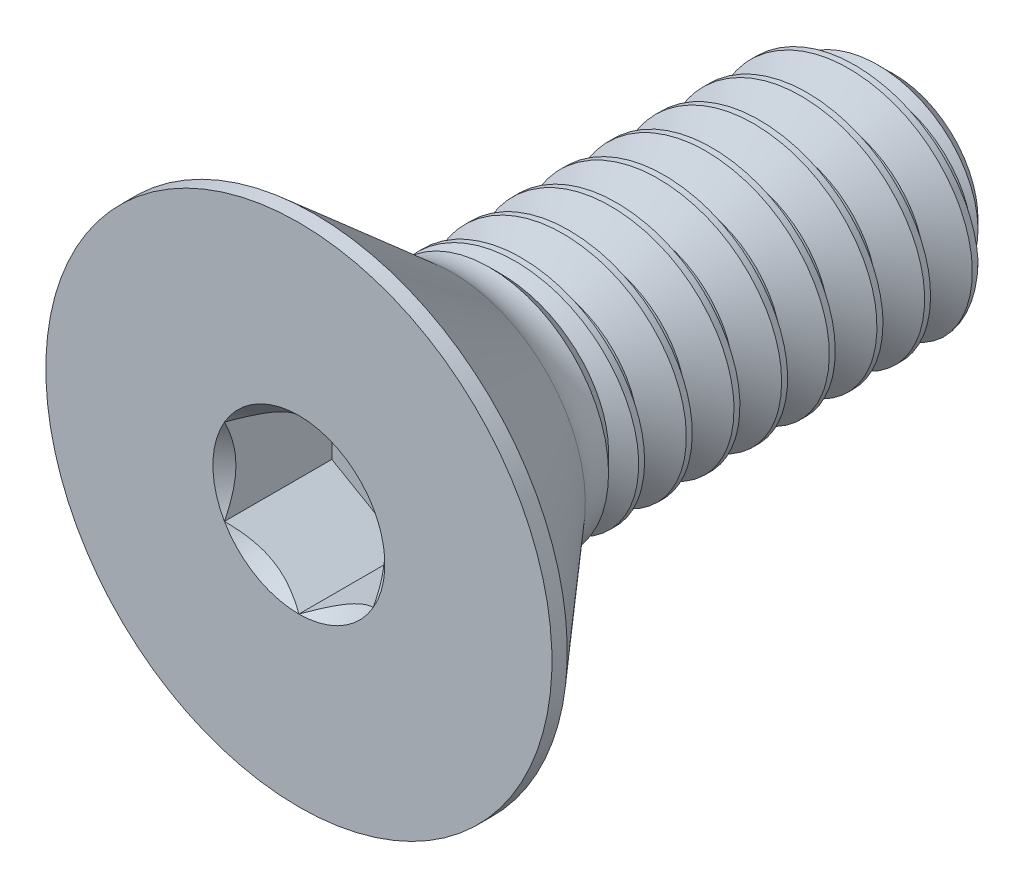
from build123d import *
from build123d.topology import SkipClean

# Parameters (mm, degrees)
SKETCH1_W          = 15.875
SKETCH1_H          = 3.175
CHAMFER1_SIZE      = 0.9525
CUT_SWEEP1_PITCH   = 1.27
CUT_EXTRUDE2_DEPTH = 2.86258


with BuildPart() as part:
    # Sketch1 → Revolve1 (revolve)
    with BuildSketch(Plane(origin=(0, 0, 0), x_dir=(0, 0, -1), z_dir=(1, 0, 0))):
        with Locations((7.9375, 1.5875)):
            Rectangle(SKETCH1_W, SKETCH1_H)
    revolve(axis=Axis((0, 0, -15.875), (0, 0, 1)))

    # Chamfer1
    chamfer1_edges = [part.edges().sort_by_distance(p)[0] for p in [
        (0, -3.175, -15.875),
    ]]
    chamfer(chamfer1_edges, length=CHAMFER1_SIZE)

    # Cut-Sweep1: the profile of Sketch2 profile screwed along a right-hand helix of 12.5 turns, 8 arcs to a turn; built about Z, then put on its axis
    with SkipClean():  # the faces are left unmerged after this step: merging them gives an invalid solid
        cut_sweep1_z = Axis((0, 0, 0), (0, 0, 1))
        cut_sweep1_corners = [(3.1756, 0, 0.00034641), (3.1756, 0, -1.11159641), (2.350110803, 0, -0.635), (2.350110803, 0, -0.47625)]
        with BuildLine(mode=Mode.PRIVATE) as cut_sweep1_profile:
            Line(cut_sweep1_corners[0], cut_sweep1_corners[1])
            Line(cut_sweep1_corners[1], cut_sweep1_corners[2])
            Line(cut_sweep1_corners[2], cut_sweep1_corners[3])
            Line(cut_sweep1_corners[3], cut_sweep1_corners[0])
        cut_sweep1_cap = Face(cut_sweep1_profile.wire())
        cut_sweep1_turn_angles = [0, 22.5, 45, 67.5, 90, 112.5, 135, 157.5, 180, 202.5, 225, 247.5, 270, 292.5, 315, 337.5, 360]
        cut_sweep1_turn_weights = [1, 0.9238795325112867, 1, 0.9238795325112867, 1, 0.9238795325112867, 1, 0.9238795325112867, 1, 0.9238795325112867, 1, 0.9238795325112867, 1, 0.9238795325112867, 1, 0.9238795325112867, 1]
        cut_sweep1_turn_rails = [Edge.make_bspline([Vector(p[0], p[1], 0).rotate(cut_sweep1_z, cut_sweep1_turn_angles[k]) / cut_sweep1_turn_weights[k] + Vector(0, 0, p[2] + CUT_SWEEP1_PITCH * cut_sweep1_turn_angles[k] / 360) for k in range(17)], [0, 0, 0, 1, 1, 2, 2, 3, 3, 4, 4, 5, 5, 6, 6, 7, 7, 8, 8, 8], 2, cut_sweep1_turn_weights) for p in cut_sweep1_corners]
        cut_sweep1_turn_sides = [Face.make_surface_from_curves(cut_sweep1_turn_rails[p[0]], cut_sweep1_turn_rails[p[1]]) for p in [(0, 1), (1, 2), (2, 3), (3, 0)]]
        cut_sweep1_last_angles = [4320, 4342.5, 4365, 4387.5, 4410, 4432.5, 4455, 4477.5, 4500]
        cut_sweep1_last_weights = [1, 0.9238795325112867, 1, 0.9238795325112867, 1, 0.9238795325112867, 1, 0.9238795325112837, 1]
        cut_sweep1_last_rails = [Edge.make_bspline([Vector(p[0], p[1], 0).rotate(cut_sweep1_z, cut_sweep1_last_angles[k]) / cut_sweep1_last_weights[k] + Vector(0, 0, p[2] + CUT_SWEEP1_PITCH * cut_sweep1_last_angles[k] / 360) for k in range(9)], [0, 0, 0, 1, 1, 2, 2, 3, 3, 4, 4, 4], 2, cut_sweep1_last_weights) for p in cut_sweep1_corners]
        cut_sweep1_last_sides = [Face.make_surface_from_curves(cut_sweep1_last_rails[p[0]], cut_sweep1_last_rails[p[1]]) for p in [(0, 1), (1, 2), (2, 3), (3, 0)]]
        cut_sweep1 = Plane(origin=(0, 0, -15.875), x_dir=(0, 1, 0), z_dir=(0, 0, 1)) * Solid(Shell([*[p.moved(Location((0, 0, CUT_SWEEP1_PITCH * i))) for i in range(12) for p in cut_sweep1_turn_sides], *cut_sweep1_last_sides, cut_sweep1_cap, cut_sweep1_cap.rotate(cut_sweep1_z, 4500).moved(Location((0, 0, CUT_SWEEP1_PITCH * 4500 / 360)))]))
        add(cut_sweep1, mode=Mode.SUBTRACT)

    # Sketch7 → Revolve2 (revolve)
    with BuildSketch(Plane(origin=(0, 0, 0), x_dir=(0, 0, -1), z_dir=(1, 0, 0)), mode=Mode.PRIVATE) as revolve2_sk:
        with BuildLine():
            Line((0, 6.7437), (0.40894, 6.7437))
            Line((0.40894, 6.7437), (4.0894, 3.544324933))
            ThreePointArc((4.0894, 3.544324933), (4.549909788, 3.270350399), (5.077204404, 3.175))
            Line((5.077204404, 3.175), (5.077204404, 0))
            Line((5.077204404, 0), (0, 0))
            Line((0, 0), (0, 6.7437))
        make_face()
    revolve(revolve2_sk.sketch.rotate(Axis((0, 0, 0), (0, 0, -1)), 189.052465709), axis=Axis((0, 0, 0), (0, 0, -1)))

    # Boss-Extrude1 cone 1 section (through the dimple's axis) → Boss-Extrude1 (revolve)
    with BuildSketch(Plane(origin=(0, 0, -5.077204404), x_dir=(0, -1, 0), z_dir=(1, 0, 0))):
        Polygon((0, 0), (3.175, 0), (0, 3.175), align=None)
    revolve(axis=Axis((0, 0, -5.077204404), (0, 0, -1)))

    # Sketch5 → Cut-Extrude2 (cut)
    with BuildSketch(Plane.XY):
        Polygon((1.984375, -1.14567944), (1.984375, 1.14567944), (0, 2.291358881), (-1.984375, 1.14567944), (-1.984375, -1.14567944), (0, -2.291358881), align=None)
    extrude(amount=-CUT_EXTRUDE2_DEPTH, mode=Mode.SUBTRACT)

    # Cut-Extrude3 cone 1 section (through the dimple's axis) → Cut-Extrude3 (revolve, cut)
    with BuildSketch(Plane(origin=(0, 0, 0), x_dir=(0, -1, 0), z_dir=(1, 0, 0))):
        Polygon((0, 0), (2.291358881, 0), (0, 2.291358881), align=None)
    revolve(axis=Axis((0, 0, 0), (0, 0, -1)), mode=Mode.SUBTRACT)


solid = part.part
